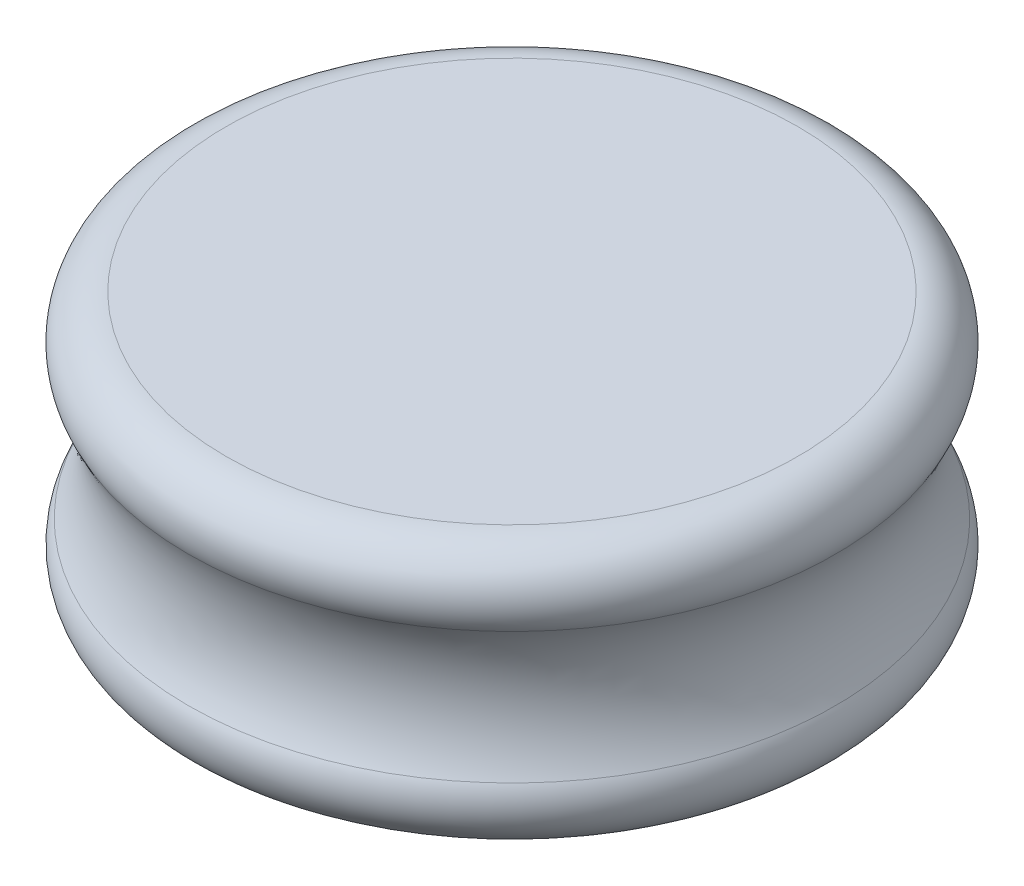
from build123d import *

# Parameters (mm, degrees)
FILLET4_R = 2
FILLET5_R = 2
FILLET6_R = 2
FILLET7_R = 2


# Some blends are built 0.0001 mm under size
with BuildPart() as part:
    # Sketch2 → Revolve1 (revolve)
    with BuildSketch(Plane.XY, mode=Mode.PRIVATE) as revolve1_sk:
        with BuildLine():
            Line((0, 0), (0, 12))
            Line((0, 12), (17, 12))
            Line((17, 12), (17, 11.196152423))
            ThreePointArc((17, 11.196152423), (14, 6), (17, 0.803847577))
            Line((17, 0.803847577), (17, 0))
            Line((17, 0), (0, 0))
        make_face()
    revolve(revolve1_sk.sketch.rotate(Axis((0, 0, 0), (0, 1, 0)), 90), axis=Axis((0, 0, 0), (0, 1, 0)))

    # Fillet4
    # the kernel refuses this fillet: 2 mm, written as the material it takes off along each edge
    with BuildSketch(Plane(origin=(0, 12, 0), x_dir=(0, 0, -1), z_dir=(1, 0, 0))) as fillet4_piece_1:
        with BuildLine():
            CenterArc((15.397121532, -2), FILLET4_R, 36.732240325, 53.267759675)
            Line((17, -0.803847577), (17.032057569, -0.779924529))
            ThreePointArc((17.032057569, -0.779924529), (17.04, -0.401923789), (17.04, 0))
            Line((17.04, 0), (17, 0.04))
            Line((17, 0.04), (15.397121532, 0.04))
            Line((15.397121532, 0.04), (15.397121532, 0))
        make_face()
    revolve(axis=Axis((0, 12, 0), (0, 1, 0)), mode=Mode.SUBTRACT)

    # Fillet5
    fillet5_edges = [part.edges().sort_by_distance(p)[0] for p in [
        (0, 11.196152423, 17),
    ]]
    fillet(fillet5_edges, radius=FILLET5_R - 0.0001)  # a hair under: the kernel refuses the full size

    # Fillet6
    # the kernel refuses this fillet: 2 mm, written as the material it takes off along each edge
    with BuildSketch(Plane(origin=(0, 0, 0), x_dir=(0, 0, -1), z_dir=(1, 0, 0))) as fillet6_piece_1:
        with BuildLine():
            CenterArc((15.397121532, 2), FILLET6_R, 270, 53.267759675)
            Line((15.397121532, 0), (15.397121532, -0.04))
            Line((15.397121532, -0.04), (17, -0.04))
            Line((17, -0.04), (17.04, 0))
            ThreePointArc((17.04, 0), (17.04, 0.401923789), (17.032057569, 0.779924529))
            Line((17.032057569, 0.779924529), (17, 0.803847577))
        make_face()
    revolve(axis=Axis((0, 0, 0), (0, 1, 0)), mode=Mode.SUBTRACT)

    # Fillet7
    fillet7_edges = [part.edges().sort_by_distance(p)[0] for p in [
        (0, 0.803847577, 17),
    ]]
    fillet(fillet7_edges, radius=FILLET7_R)


solid = part.part
